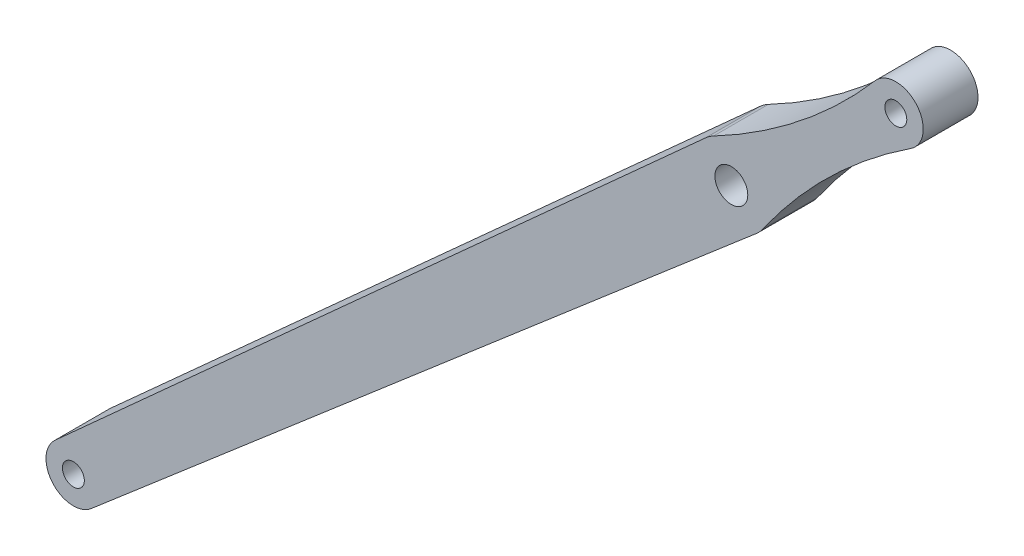
from build123d import *

# Parameters (mm, degrees)
BOSS_EXTRUDE1_DEPTH      = 5
BOSS_EXTRUDE1_DEPTH_BACK = 5
SKETCH1_R                = 3
SKETCH1_R_2              = 2


with BuildPart() as part:
    # Sketch1 → Boss-Extrude1 (new, two sides: drawn at the far end of the back side and taken through both)
    with BuildSketch(Plane.XY.offset(-BOSS_EXTRUDE1_DEPTH_BACK)):
        with BuildLine():
            Line((-246.720615423, 11.072807848), (-125.308676588, 115.260816315))
            ThreePointArc((-125.308676588, 115.260816315), (-124.679105794, 115.873740373), (-124.131278606, 116.560705187))
            ThreePointArc((-124.131278606, 116.560705187), (-111.861295984, 130.975908674), (-97.094592458, 142.820529059))
            ThreePointArc((-97.094592458, 142.820529059), (-96.0864649, 150.302753249), (-103.63613829, 150.253440879))
            ThreePointArc((-103.63613829, 150.253440879), (-117.260933849, 137.111313537), (-133.118262133, 126.772275631))
            ThreePointArc((-133.118262133, 126.772275631), (-133.8692632, 126.316169632), (-134.557209386, 125.769575332))
            Line((-134.557209386, 125.769575332), (-253.326710279, 18.579064289))
            ThreePointArc((-253.326710279, 18.579064289), (-253.73016655, 11.563921878), (-246.720615423, 11.072807848))
        make_face()
        with Locations((-129.867258111, 120.57300367)):
            Circle(SKETCH1_R, mode=Mode.SUBTRACT)
        with Locations((-249.976745082, 14.867227387)):
            Circle(SKETCH1_R_2, mode=Mode.SUBTRACT)
        with Locations((-99.839886368, 146.99944774)):
            Circle(SKETCH1_R_2, mode=Mode.SUBTRACT)
    extrude(amount=BOSS_EXTRUDE1_DEPTH + BOSS_EXTRUDE1_DEPTH_BACK)


solid = part.part
